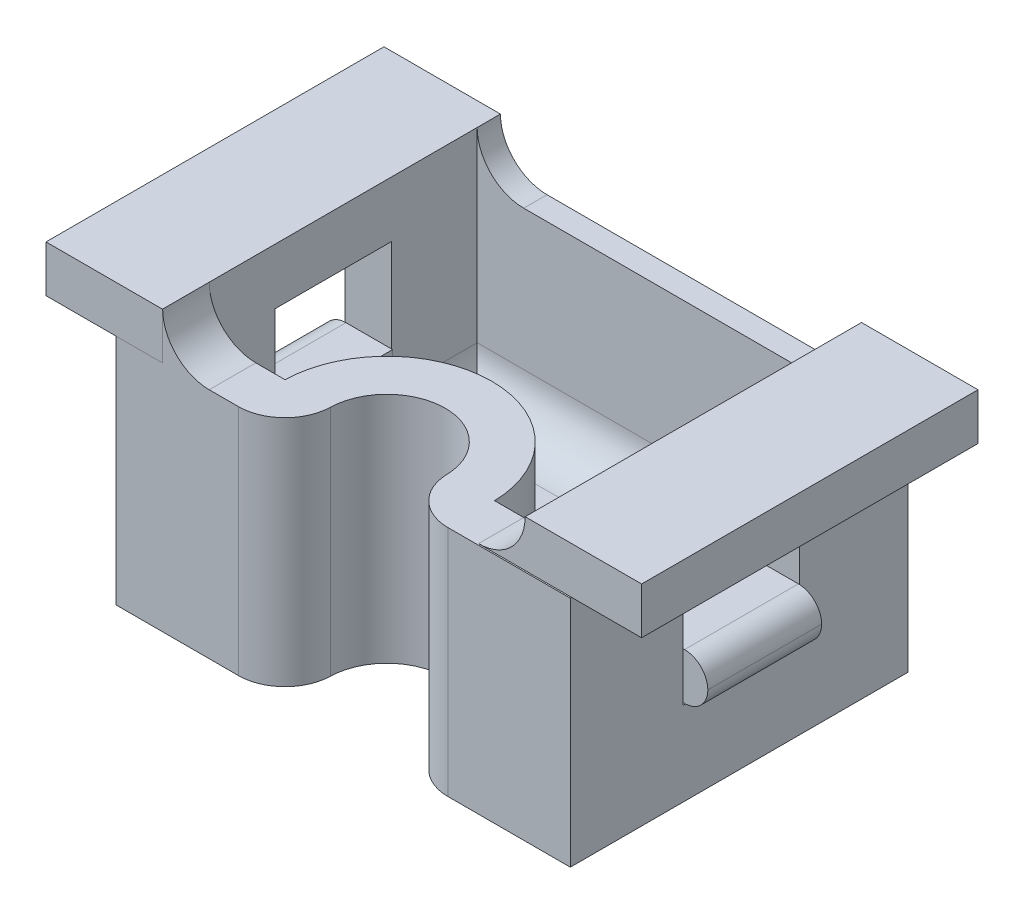
from build123d import *

# Parameters (mm, degrees)
SKETCH1_W           = 19.5
SKETCH1_H           = 14.5
BOSS_EXTRUDE1_DEPTH = 10
SKETCH2_R           = 2.5
CUT_EXTRUDE1_DEPTH  = 10
SHELL1_T            = -2
FILLET1_R           = 2
SKETCH3_W           = 15.5
SKETCH3_H           = 1
CUT_EXTRUDE3_DEPTH  = 8
FILLET2_R           = 2
SKETCH4_W           = 5
SKETCH4_H           = 14.507593663
SKETCH4_H_2         = 14.440076449
BOSS_EXTRUDE2_DEPTH = 2
FILLET3_R           = 2
FILLET4_R           = 2
SKETCH5_W           = 5
SKETCH5_H           = 6
CUT_EXTRUDE4_DEPTH  = 22
SKETCH6_W           = 3
SKETCH6_H           = 4.886451311
BOSS_EXTRUDE3_DEPTH = 2
FILLET5_R           = 1


# Some blends are built 0.0001 mm under size
with BuildPart() as part:
    # Sketch1 → Boss-Extrude1 (new body)
    with BuildSketch(Plane(origin=(0, 0, 0), x_dir=(1, 0, 0), z_dir=(0, 1, 0))):
        with Locations((-15.762004242, 10.336365648)):
            Rectangle(SKETCH1_W, SKETCH1_H)
    extrude(amount=BOSS_EXTRUDE1_DEPTH)

    # Sketch2 → Cut-Extrude1 (cut)
    with BuildSketch(Plane(origin=(0, 10, 0), x_dir=(1, 0, 0), z_dir=(0, 1, 0))):
        with Locations((-15.762004242, 4.966482791)):
            Circle(SKETCH2_R)
    extrude(amount=-CUT_EXTRUDE1_DEPTH, mode=Mode.SUBTRACT)

    # Shell1
    shell1_openings = [part.faces().sort_by_distance(p)[0] for p in [
        (-15.762004242, 10, -10.695281365),
    ]]
    offset(amount=SHELL1_T, openings=shell1_openings, kind=Kind.INTERSECTION)

    # Fillet1
    fillet1_edges = [part.edges().sort_by_distance(p)[0] for p in [
        (-17.409778355, 5, -3.086365648),
        (-14.114230128, 5, -3.086365648),
    ]]
    fillet(fillet1_edges, radius=FILLET1_R)

    # Sketch3 → Cut-Extrude3 (cut)
    with BuildSketch(Plane(origin=(0, 10, 0), x_dir=(1, 0, 0), z_dir=(0, 1, 0))):
        with Locations((-15.762004242, 16.086365648)):
            Rectangle(SKETCH3_W, SKETCH3_H)
    extrude(amount=-CUT_EXTRUDE3_DEPTH, mode=Mode.SUBTRACT)

    # Fillet2
    # the kernel refuses this fillet: 2 mm, written as the material it adds along each edge
    with BuildSketch(Plane(origin=(-15.762004242, 2, -4.966482791), x_dir=(0.4658564831234789, 0, 0.8848602924370738), z_dir=(-0.8848602924370738, 0, 0.4658564831234789))) as fillet2_piece_1_section:
        with BuildLine():
            CenterArc((4.5 + FILLET2_R, FILLET2_R), FILLET2_R, 180, 90)
            Line((4.5, FILLET2_R), (4.5, 0))
            Line((4.5, 0), (4.5 + FILLET2_R, 0))
        make_face()
    fillet2_piece_1 = revolve(axis=Axis((-15.762004242, 2, -4.966482791), (0, 1, 0)), revolution_arc=304.468667484, mode=Mode.PRIVATE)
    fillet2_piece_1 = split(fillet2_piece_1, bisect_by=Plane(origin=(-15.762004242, 2.56810824, -5.086365648), z_dir=(0, 0, -1)), keep=Keep.TOP, mode=Mode.PRIVATE)
    add(fillet2_piece_1)
    with BuildSketch(Plane(origin=(-8.012004242, 2, -16.586365648), x_dir=(-1, 0, 0), z_dir=(0, 0, 1)), Plane(origin=(-23.512004242, 2, -5.086365648), x_dir=(1, 0, 0), z_dir=(0, 0, -1))) as fillet2_piece_2:
        with BuildLine():
            CenterArc((FILLET2_R, -FILLET2_R), FILLET2_R, 90, 90)
            Line((0, -FILLET2_R), (0, 0))
            Line((0, 0), (FILLET2_R, 0))
        make_face()
    extrude(amount=11.5)
    with BuildSketch(Plane(origin=(-8.012004242, 2, -16.586365648), x_dir=(0, 1, 0), z_dir=(-1, 0, 0))) as fillet2_piece_3:
        with BuildLine():
            CenterArc((FILLET2_R, -FILLET2_R), FILLET2_R, 90, 90)
            Line((0, -FILLET2_R), (0, 0))
            Line((0, 0), (FILLET2_R, 0))
        make_face()
    extrude(amount=15.5)

    # Sketch4 → Boss-Extrude2 (add)
    with BuildSketch(Plane(origin=(0, 10, 0), x_dir=(1, 0, 0), z_dir=(0, 1, 0))):
        with Locations((-26.012004242, 10.332568817)):
            Rectangle(SKETCH4_W, SKETCH4_H)
        with Locations((-5.512004242, 10.366327424)):
            Rectangle(SKETCH4_W, SKETCH4_H_2)
    extrude(amount=BOSS_EXTRUDE2_DEPTH)

    # Fillet3
    fillet3_edges = [part.edges().sort_by_distance(p)[0] for p in [
        (-8.012004242, 10, -4.116327424),
        (-23.512004242, 10, -4.086365648),
    ]]
    fillet(fillet3_edges, radius=FILLET3_R - 0.0001)  # a hair under: the kernel refuses the full size

    # Fillet4
    fillet4_edges = [part.edges().sort_by_distance(p)[0] for p in [
        (-23.512004242, 10, -17.086365648),
        (-8.012004242, 10, -17.086365648),
    ]]
    fillet(fillet4_edges, radius=FILLET4_R - 0.0001)  # a hair under: the kernel refuses the full size

    # Sketch5 → Cut-Extrude4 (cut)
    with BuildSketch(Plane.ZY.offset(25.512004242)):
        with Locations((-10.415649008, 6.599188408)):
            Rectangle(SKETCH5_W, SKETCH5_H)
    extrude(amount=-CUT_EXTRUDE4_DEPTH, mode=Mode.SUBTRACT)

    # Sketch6 → Boss-Extrude3 (add)
    with BuildSketch(Plane(origin=(0, 3.599188408, 0), x_dir=(1, 0, 0), z_dir=(0, 1, 0))):
        with Locations((-24.971430195, 10.472423353)):
            Rectangle(SKETCH6_W, SKETCH6_H)
        with Locations((-6.552578288, 10.472423353)):
            Rectangle(SKETCH6_W, SKETCH6_H)
    extrude(amount=BOSS_EXTRUDE3_DEPTH)

    # Fillet5
    # the kernel refuses this fillet: 1 mm, written as the material it takes off along each edge
    with BuildSketch(Plane(origin=(-5.052578288, 3.599188408, -15.415649008), x_dir=(0, 1, 0), z_dir=(0, 0, 1))) as fillet5_piece_1_section:
        with BuildLine():
            CenterArc((FILLET5_R, FILLET5_R), FILLET5_R, 180, 90)
            Line((0, FILLET5_R), (0, 0))
            Line((0, 0), (FILLET5_R, 0))
        make_face()
    fillet5_piece_1 = extrude(amount=9.886451311, mode=Mode.PRIVATE)
    fillet5_piece_1 = split(fillet5_piece_1, bisect_by=Plane(origin=(-6.012004242, 3.822567924, -10.472423353), z_dir=(1, 0, 0)), keep=Keep.TOP, mode=Mode.PRIVATE)
    add(fillet5_piece_1, mode=Mode.SUBTRACT)
    with BuildSketch(Plane(origin=(-5.052578288, 5.599188408, -12.915649008), x_dir=(-1, 0, 0), z_dir=(0, 0, 1))) as fillet5_piece_2:
        with BuildLine():
            CenterArc((FILLET5_R, FILLET5_R), FILLET5_R, 180, 90)
            Line((0, FILLET5_R), (0, 0))
            Line((0, 0), (FILLET5_R, 0))
        make_face()
    extrude(amount=4.886451311, mode=Mode.SUBTRACT)
    with BuildSketch(Plane(origin=(-26.471430195, 3.599188408, -15.415649008), x_dir=(1, 0, 0), z_dir=(0, 0, 1))) as fillet5_piece_3_section:
        with BuildLine():
            CenterArc((FILLET5_R, FILLET5_R), FILLET5_R, 180, 90)
            Line((0, FILLET5_R), (0, 0))
            Line((0, 0), (FILLET5_R, 0))
        make_face()
    fillet5_piece_3 = extrude(amount=9.886451311, mode=Mode.PRIVATE)
    fillet5_piece_3 = split(fillet5_piece_3, bisect_by=Plane(origin=(-25.512004242, 3.822567924, -10.472423353), z_dir=(-1, 0, 0)), keep=Keep.TOP, mode=Mode.PRIVATE)
    add(fillet5_piece_3, mode=Mode.SUBTRACT)
    with BuildSketch(Plane(origin=(-26.471430195, 5.599188408, -12.915649008), x_dir=(1, 0, 0), z_dir=(0, 0, 1))) as fillet5_piece_4:
        with BuildLine():
            CenterArc((FILLET5_R, -FILLET5_R), FILLET5_R, 90, 90)
            Line((0, -FILLET5_R), (0, 0))
            Line((0, 0), (FILLET5_R, 0))
        make_face()
    extrude(amount=4.886451311, mode=Mode.SUBTRACT)


solid = part.part
